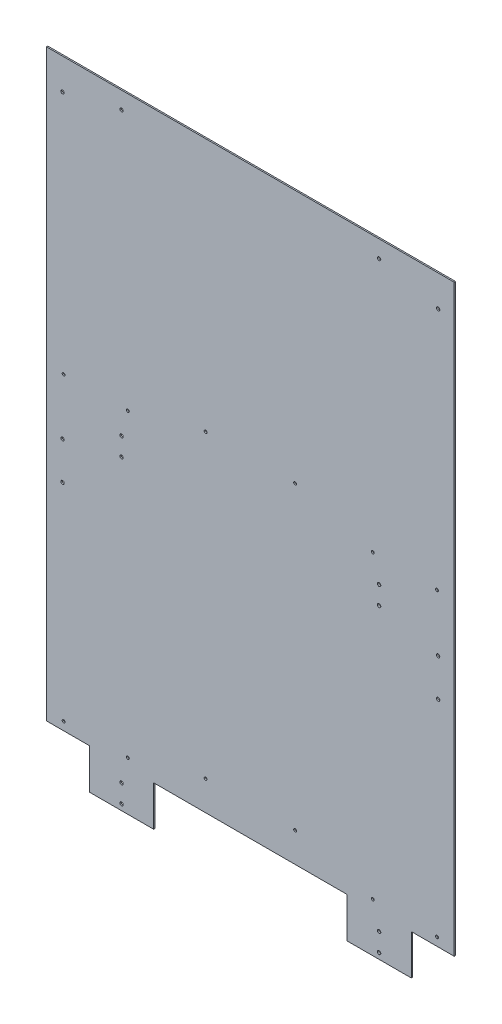
from build123d import *

# Parameters (mm, degrees)
BOSS_EXTRUDE1_DEPTH            = 3.175
F_1_4_CLEARANCE_HOLE1_D        = 6.7564
F_5_16_0_3125_DIAMETER_HOLE1_D = 7.9375
SKETCH7_W                      = 965.2
SKETCH7_H                      = 27.94
CUT_EXTRUDE1_DEPTH             = 1491.022459772


with BuildPart() as part:
    # Sketch2 → Boss-Extrude1 (new body)
    with BuildSketch(Plane.XY):
        Polygon((-482.6, 0), (-381, 0), (-381, -95.25), (-228.6, -95.25), (-228.6, 0), (228.6, 0), (228.6, -95.25), (381, -95.25), (381, 0), (482.6, 0), (482.6, 1409.7), (-482.6, 1409.7), align=None)
    extrude(amount=BOSS_EXTRUDE1_DEPTH)

    # 1/4 Clearance Hole1 (through all)
    with Locations(Plane.XY.offset(3.175)):
        with Locations((441.96, 730.60918615), (105.907561142, 70.010143283), (289.91643105, 20.705115191), (-289.91643105, 20.705115191), (-105.907561142, 70.010143283), (105.907561142, 781.210143283), (289.91643105, 731.905115191), (-289.91643105, 731.905115191), (-105.907561142, 781.210143283), (441.96, 19.40918615), (-441.96, 19.40918615), (-441.96, 730.60918615)):
            Hole(F_1_4_CLEARANCE_HOLE1_D / 2)

    # 5/16 (0.3125) Diameter Hole1 (through all)
    with Locations(Plane.XY.offset(3.175)):
        with Locations((444.5, 508), (-304.8, 1341.12), (304.8, 1341.12), (-304.8, 673.1), (-304.8, 629.92), (304.8, 673.1), (304.8, 629.92), (-304.8, -38.1), (-304.8, -81.28), (304.8, -38.1), (304.8, -81.28), (-444.5, 1308.1), (444.5, 1308.1), (-444.5, 596.9), (444.5, 596.9), (-444.5, 508)):
            Hole(F_5_16_0_3125_DIAMETER_HOLE1_D / 2)

    # Sketch7 → Cut-Extrude1 (cut, through all)
    with BuildSketch(Plane.XY.offset(3.175)):
        with Locations((0, 1395.73)):
            Rectangle(SKETCH7_W, SKETCH7_H)
    extrude(amount=-CUT_EXTRUDE1_DEPTH, mode=Mode.SUBTRACT)


solid = part.part
